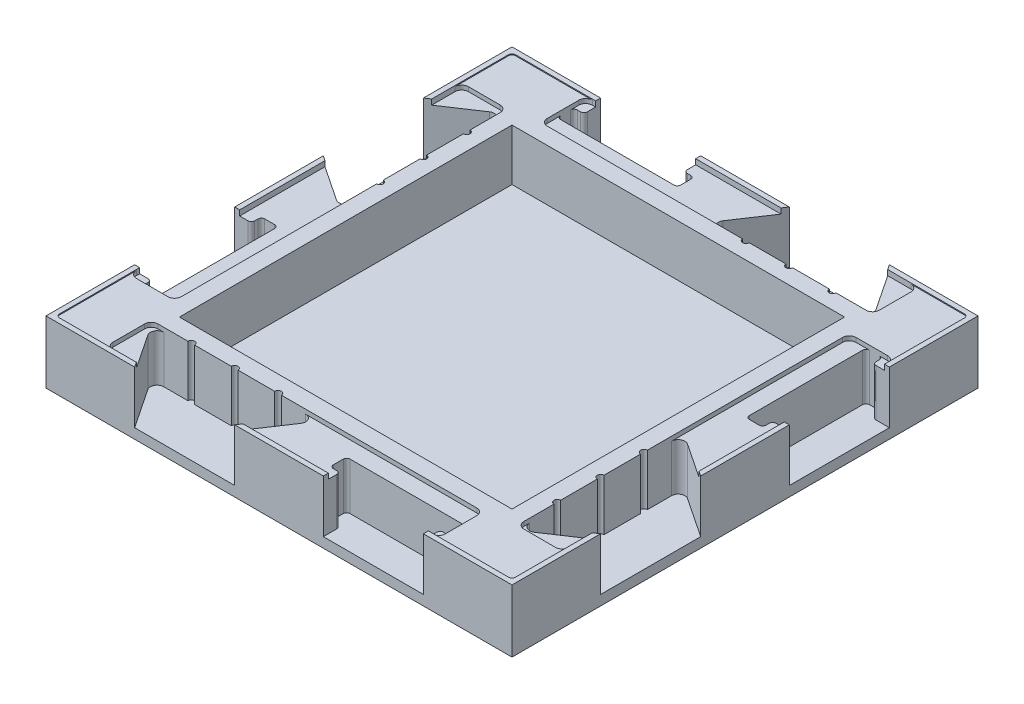
from build123d import *

# Parameters (mm, degrees)
SKETCH1_W           = 139.7
SKETCH1_H           = 139.7
BOSS_EXTRUDE1_DEPTH = 9.375
SKETCH2_W           = 136.7
SKETCH2_H           = 136.7
CUT_EXTRUDE1_DEPTH  = 0.3
CUT_EXTRUDE2_START  = -15.75
CUT_EXTRUDE2_DEPTH  = 117.296543949
CUT_EXTRUDE4_DEPTH  = 15.45
SKETCH9_W           = 99.566666666
SKETCH9_H           = 13.5
CUT_EXTRUDE5_DEPTH  = 1.3
FILLET1_R           = 1
FILLET3_R           = 2
FILLET4_R           = 2
CIRPATTERN1_START   = -6.375
CIRPATTERN1_DEPTH   = 15.75
CIRPATTERN1_START_2 = 7.775
CIRPATTERN1_2_DEPTH = 1.3
SKETCH11_W          = 99.7
SKETCH11_H          = 99.7
CUT_EXTRUDE6_DEPTH  = 15.45


# Read off the part's stored shape, not the designer's step: CirPattern1
with BuildPart() as part:
    # Sketch1 → Boss-Extrude1 (new, symmetric)
    with BuildSketch(Plane(origin=(0, 0, 0), x_dir=(1, 0, 0), z_dir=(0, 1, 0))):
        Rectangle(SKETCH1_W, SKETCH1_H)
    extrude(amount=BOSS_EXTRUDE1_DEPTH, both=True)

    # Sketch2 → Cut-Extrude1 (cut)
    with BuildSketch(Plane(origin=(0, 9.375, 0), x_dir=(1, 0, 0), z_dir=(0, 1, 0))):
        Rectangle(SKETCH2_W, SKETCH2_H)
    extrude(amount=-CUT_EXTRUDE1_DEPTH, mode=Mode.SUBTRACT)

    # Sketch4 → Cut-Extrude2 (cut)
    with BuildSketch(Plane(origin=(0, 9.375, 0), x_dir=(1, 0, 0), z_dir=(0, 1, 0)).offset(CUT_EXTRUDE2_START)):
        Polygon((-43.283333333, -69.85), (-53.283333333, -54.85), (-3.283333333, -54.85), (-13.283333333, -69.85), align=None)
        Polygon((13.283333333, -69.85), (13.283333333, -64.85), (10.283333333, -64.85), (10.283333333, -59.85), (46.283333333, -59.85), (46.283333333, -64.85), (43.283333333, -64.85), (43.283333333, -69.85), align=None)
    extrude(amount=CUT_EXTRUDE2_DEPTH, mode=Mode.SUBTRACT)

    # Sketch6 → Cut-Extrude4 (cut)
    with BuildSketch(Plane(origin=(0, 9.075, 0), x_dir=(1, 0, 0), z_dir=(0, 1, 0))):
        with BuildLine():
            Line((-42.283333333, -54.85), (-40.283333333, -54.85))
            ThreePointArc((-40.283333333, -54.85), (-41.283333333, -53.85), (-42.283333333, -54.85))
        make_face()
        with BuildLine():
            Line((-29.283333333, -54.85), (-27.283333333, -54.85))
            ThreePointArc((-27.283333333, -54.85), (-28.283333333, -53.85), (-29.283333333, -54.85))
        make_face()
        with BuildLine():
            Line((-16.283333333, -54.85), (-14.283333333, -54.85))
            ThreePointArc((-14.283333333, -54.85), (-15.283333333, -53.85), (-16.283333333, -54.85))
        make_face()
    extrude(amount=-CUT_EXTRUDE4_DEPTH, mode=Mode.SUBTRACT)

    # Sketch9 → Cut-Extrude5 (cut)
    with BuildSketch(Plane(origin=(0, 9.075, 0), x_dir=(1, 0, 0), z_dir=(0, 1, 0))):
        with Locations((-3.5, -61.6)):
            Rectangle(SKETCH9_W, SKETCH9_H)
    extrude(amount=-CUT_EXTRUDE5_DEPTH, mode=Mode.SUBTRACT)

    # Fillet1
    fillet1_edges = [part.edges().sort_by_distance(p)[0] for p in [
        (-68.35, 9.225, -68.35),
        (-68.35, 9.225, 68.35),
        (68.35, 9.225, 68.35),
        (68.35, 9.225, -68.35),
        (46.283333333, 0.7, 64.85),
        (46.283333333, 0.7, 59.85),
        (10.283333333, 0.7, 59.85),
        (10.283333333, 0.7, 64.85),
        (13.283333333, 0.7, 64.85),
        (43.283333333, 0.7, 64.85),
    ]]
    fillet(fillet1_edges, radius=FILLET1_R)

    # Fillet3
    fillet3_edges = [part.edges().sort_by_distance(p)[0] for p in [
        (-53.283333333, 0.7, 54.85),
        (-3.283333333, 0.7, 54.85),
    ]]
    fillet(fillet3_edges, radius=FILLET3_R)

    # Fillet4
    fillet4_edges = [part.edges().sort_by_distance(p)[0] for p in [
        (46.283333333, 8.425, 54.85),
        (46.283333333, 8.425, 68.35),
        (-53.283333333, 8.425, 54.85),
        (-53.283333333, 8.425, 68.35),
    ]]
    fillet(fillet4_edges, radius=FILLET4_R)

    # CirPattern1 outline → CirPattern1 (cut)
    with BuildSketch(Plane(origin=(0, 0, 0), x_dir=(1, 0, 0), z_dir=(0, 1, 0)).offset(CIRPATTERN1_START)):
        with BuildLine():
            ThreePointArc((54.85, -14.283333333), (53.85, -15.283333333), (54.85, -16.283333333))
            Line((54.85, -16.283333333), (54.85, -27.283333333))
            ThreePointArc((54.85, -27.283333333), (53.85, -28.283333333), (54.85, -29.283333333))
            Line((54.85, -29.283333333), (54.85, -40.283333333))
            ThreePointArc((54.85, -40.283333333), (53.85, -41.283333333), (54.85, -42.283333333))
            Line((54.85, -42.283333333), (54.85, -49.54629915))
            ThreePointArc((54.85, -49.54629915), (55.906284149, -51.309648347), (57.959400392, -51.210399738))
            Line((57.959400392, -51.210399738), (69.85, -43.283333333))
            Line((69.85, -43.283333333), (69.85, -13.283333333))
            Line((69.85, -13.283333333), (57.959400392, -5.356266928))
            ThreePointArc((57.959400392, -5.356266928), (55.906284149, -5.257018319), (54.85, -7.020367517))
            Line((54.85, -7.020367517), (54.85, -14.283333333))
        make_face()
        with BuildLine():
            Line((-69.85, 43.283333333), (-69.85, 13.283333333))
            Line((-69.85, 13.283333333), (-57.959400392, 5.356266928))
            ThreePointArc((-57.959400392, 5.356266928), (-55.906284149, 5.257018319), (-54.85, 7.020367517))
            Line((-54.85, 7.020367517), (-54.85, 14.283333333))
            ThreePointArc((-54.85, 14.283333333), (-53.85, 15.283333333), (-54.85, 16.283333333))
            Line((-54.85, 16.283333333), (-54.85, 27.283333333))
            ThreePointArc((-54.85, 27.283333333), (-53.85, 28.283333333), (-54.85, 29.283333333))
            Line((-54.85, 29.283333333), (-54.85, 40.283333333))
            ThreePointArc((-54.85, 40.283333333), (-53.85, 41.283333333), (-54.85, 42.283333333))
            Line((-54.85, 42.283333333), (-54.85, 49.54629915))
            ThreePointArc((-54.85, 49.54629915), (-55.906284149, 51.309648347), (-57.959400392, 51.210399738))
            Line((-57.959400392, 51.210399738), (-69.85, 43.283333333))
        make_face()
        with BuildLine():
            Line((43.283333333, 69.85), (13.283333333, 69.85))
            Line((13.283333333, 69.85), (5.356266928, 57.959400392))
            ThreePointArc((5.356266928, 57.959400392), (5.257018319, 55.906284149), (7.020367517, 54.85))
            Line((7.020367517, 54.85), (14.283333333, 54.85))
            ThreePointArc((14.283333333, 54.85), (15.283333333, 53.85), (16.283333333, 54.85))
            Line((16.283333333, 54.85), (27.283333333, 54.85))
            ThreePointArc((27.283333333, 54.85), (28.283333333, 53.85), (29.283333333, 54.85))
            Line((29.283333333, 54.85), (40.283333333, 54.85))
            ThreePointArc((40.283333333, 54.85), (41.283333333, 53.85), (42.283333333, 54.85))
            Line((42.283333333, 54.85), (49.54629915, 54.85))
            ThreePointArc((49.54629915, 54.85), (51.309648347, 55.906284149), (51.210399738, 57.959400392))
            Line((51.210399738, 57.959400392), (43.283333333, 69.85))
        make_face()
        with BuildLine():
            Line((63.85, 46.283333333), (60.85, 46.283333333))
            ThreePointArc((60.85, 46.283333333), (60.142893218, 45.990440115), (59.85, 45.283333333))
            Line((59.85, 45.283333333), (59.85, 11.283333333))
            ThreePointArc((59.85, 11.283333333), (60.142893219, 10.576226552), (60.85, 10.283333333))
            Line((60.85, 10.283333333), (63.85, 10.283333333))
            ThreePointArc((63.85, 10.283333333), (64.557106781, 10.576226552), (64.85, 11.283333333))
            Line((64.85, 11.283333333), (64.85, 12.283333333))
            ThreePointArc((64.85, 12.283333333), (65.142893218, 12.990440114), (65.85, 13.283333333))
            Line((65.85, 13.283333333), (69.85, 13.283333333))
            Line((69.85, 13.283333333), (69.85, 43.283333333))
            Line((69.85, 43.283333333), (65.85, 43.283333333))
            ThreePointArc((65.85, 43.283333333), (65.142893219, 43.576226552), (64.85, 44.283333333))
            Line((64.85, 44.283333333), (64.85, 45.283333333))
            ThreePointArc((64.85, 45.283333333), (64.557106781, 45.990440115), (63.85, 46.283333333))
        make_face()
        with BuildLine():
            Line((-13.283333333, 69.85), (-43.283333333, 69.85))
            Line((-43.283333333, 69.85), (-43.283333333, 65.85))
            ThreePointArc((-43.283333333, 65.85), (-43.576226552, 65.142893219), (-44.283333333, 64.85))
            Line((-44.283333333, 64.85), (-45.283333333, 64.85))
            ThreePointArc((-45.283333333, 64.85), (-45.990440115, 64.557106781), (-46.283333333, 63.85))
            Line((-46.283333333, 63.85), (-46.283333333, 60.85))
            ThreePointArc((-46.283333333, 60.85), (-45.990440115, 60.142893218), (-45.283333333, 59.85))
            Line((-45.283333333, 59.85), (-11.283333333, 59.85))
            ThreePointArc((-11.283333333, 59.85), (-10.576226552, 60.142893219), (-10.283333333, 60.85))
            Line((-10.283333333, 60.85), (-10.283333333, 63.85))
            ThreePointArc((-10.283333333, 63.85), (-10.576226552, 64.557106781), (-11.283333333, 64.85))
            Line((-11.283333333, 64.85), (-12.283333333, 64.85))
            ThreePointArc((-12.283333333, 64.85), (-12.990440114, 65.142893218), (-13.283333333, 65.85))
            Line((-13.283333333, 65.85), (-13.283333333, 69.85))
        make_face()
        with BuildLine():
            Line((-69.85, -13.283333333), (-69.85, -43.283333333))
            Line((-69.85, -43.283333333), (-65.85, -43.283333333))
            ThreePointArc((-65.85, -43.283333333), (-65.142893219, -43.576226552), (-64.85, -44.283333333))
            Line((-64.85, -44.283333333), (-64.85, -45.283333333))
            ThreePointArc((-64.85, -45.283333333), (-64.557106781, -45.990440115), (-63.85, -46.283333333))
            Line((-63.85, -46.283333333), (-60.85, -46.283333333))
            ThreePointArc((-60.85, -46.283333333), (-60.142893218, -45.990440115), (-59.85, -45.283333333))
            Line((-59.85, -45.283333333), (-59.85, -11.283333333))
            ThreePointArc((-59.85, -11.283333333), (-60.142893219, -10.576226552), (-60.85, -10.283333333))
            Line((-60.85, -10.283333333), (-63.85, -10.283333333))
            ThreePointArc((-63.85, -10.283333333), (-64.557106781, -10.576226552), (-64.85, -11.283333333))
            Line((-64.85, -11.283333333), (-64.85, -12.283333333))
            ThreePointArc((-64.85, -12.283333333), (-65.142893218, -12.990440114), (-65.85, -13.283333333))
            Line((-65.85, -13.283333333), (-69.85, -13.283333333))
        make_face()
    extrude(amount=CIRPATTERN1_DEPTH, mode=Mode.SUBTRACT)

    # CirPattern1 2 outline → CirPattern1 2 (cut)
    with BuildSketch(Plane(origin=(0, 0, 0), x_dir=(1, 0, 0), z_dir=(0, 1, 0)).offset(CIRPATTERN1_START_2)):
        with BuildLine():
            Line((54.85, 44.283333333), (54.85, -7.020367517))
            ThreePointArc((54.85, -7.020367517), (55.906284149, -5.257018319), (57.959400392, -5.356266928))
            Line((57.959400392, -5.356266928), (68.35, -12.283333333))
            Line((68.35, -12.283333333), (68.35, 13.283333333))
            Line((68.35, 13.283333333), (65.85, 13.283333333))
            ThreePointArc((65.85, 13.283333333), (65.142893218, 12.990440114), (64.85, 12.283333333))
            Line((64.85, 12.283333333), (64.85, 11.283333333))
            ThreePointArc((64.85, 11.283333333), (64.557106781, 10.576226552), (63.85, 10.283333333))
            Line((63.85, 10.283333333), (60.85, 10.283333333))
            ThreePointArc((60.85, 10.283333333), (60.142893219, 10.576226552), (59.85, 11.283333333))
            Line((59.85, 11.283333333), (59.85, 45.283333333))
            ThreePointArc((59.85, 45.283333333), (60.142893218, 45.990440115), (60.85, 46.283333333))
            Line((60.85, 46.283333333), (56.85, 46.283333333))
            ThreePointArc((56.85, 46.283333333), (55.435786438, 45.697546896), (54.85, 44.283333333))
        make_face()
        with BuildLine():
            ThreePointArc((57.959400392, -51.210399738), (55.906284149, -51.309648347), (54.85, -49.54629915))
            Line((54.85, -49.54629915), (54.85, -51.283333333))
            ThreePointArc((54.85, -51.283333333), (55.435786438, -52.697546896), (56.85, -53.283333333))
            Line((56.85, -53.283333333), (66.35, -53.283333333))
            ThreePointArc((66.35, -53.283333333), (67.764213562, -52.697546896), (68.35, -51.283333333))
            Line((68.35, -51.283333333), (68.35, -44.283333333))
            Line((68.35, -44.283333333), (57.959400392, -51.210399738))
        make_face()
        with BuildLine():
            Line((66.35, 46.283333333), (63.85, 46.283333333))
            ThreePointArc((63.85, 46.283333333), (64.557106781, 45.990440115), (64.85, 45.283333333))
            Line((64.85, 45.283333333), (64.85, 44.283333333))
            ThreePointArc((64.85, 44.283333333), (65.142893219, 43.576226552), (65.85, 43.283333333))
            Line((65.85, 43.283333333), (68.35, 43.283333333))
            Line((68.35, 43.283333333), (68.35, 44.283333333))
            ThreePointArc((68.35, 44.283333333), (67.764213562, 45.697546896), (66.35, 46.283333333))
        make_face()
        with BuildLine():
            Line((51.283333333, 68.35), (44.283333333, 68.35))
            Line((44.283333333, 68.35), (51.210399738, 57.959400392))
            ThreePointArc((51.210399738, 57.959400392), (51.309648347, 55.906284149), (49.54629915, 54.85))
            Line((49.54629915, 54.85), (51.283333333, 54.85))
            ThreePointArc((51.283333333, 54.85), (52.697546896, 55.435786438), (53.283333333, 56.85))
            Line((53.283333333, 56.85), (53.283333333, 66.35))
            ThreePointArc((53.283333333, 66.35), (52.697546896, 67.764213562), (51.283333333, 68.35))
        make_face()
        with BuildLine():
            Line((5.356266928, 57.959400392), (12.283333333, 68.35))
            Line((12.283333333, 68.35), (-13.283333333, 68.35))
            Line((-13.283333333, 68.35), (-13.283333333, 65.85))
            ThreePointArc((-13.283333333, 65.85), (-12.990440114, 65.142893218), (-12.283333333, 64.85))
            Line((-12.283333333, 64.85), (-11.283333333, 64.85))
            ThreePointArc((-11.283333333, 64.85), (-10.576226552, 64.557106781), (-10.283333333, 63.85))
            Line((-10.283333333, 63.85), (-10.283333333, 60.85))
            ThreePointArc((-10.283333333, 60.85), (-10.576226552, 60.142893219), (-11.283333333, 59.85))
            Line((-11.283333333, 59.85), (-45.283333333, 59.85))
            ThreePointArc((-45.283333333, 59.85), (-45.990440115, 60.142893218), (-46.283333333, 60.85))
            Line((-46.283333333, 60.85), (-46.283333333, 56.85))
            ThreePointArc((-46.283333333, 56.85), (-45.697546896, 55.435786438), (-44.283333333, 54.85))
            Line((-44.283333333, 54.85), (7.020367517, 54.85))
            ThreePointArc((7.020367517, 54.85), (5.257018319, 55.906284149), (5.356266928, 57.959400392))
        make_face()
        with BuildLine():
            Line((-43.283333333, 65.85), (-43.283333333, 68.35))
            Line((-43.283333333, 68.35), (-44.283333333, 68.35))
            ThreePointArc((-44.283333333, 68.35), (-45.697546896, 67.764213562), (-46.283333333, 66.35))
            Line((-46.283333333, 66.35), (-46.283333333, 63.85))
            ThreePointArc((-46.283333333, 63.85), (-45.990440115, 64.557106781), (-45.283333333, 64.85))
            Line((-45.283333333, 64.85), (-44.283333333, 64.85))
            ThreePointArc((-44.283333333, 64.85), (-43.576226552, 65.142893219), (-43.283333333, 65.85))
        make_face()
        with BuildLine():
            Line((-68.35, 51.283333333), (-68.35, 44.283333333))
            Line((-68.35, 44.283333333), (-57.959400392, 51.210399738))
            ThreePointArc((-57.959400392, 51.210399738), (-55.906284149, 51.309648347), (-54.85, 49.54629915))
            Line((-54.85, 49.54629915), (-54.85, 51.283333333))
            ThreePointArc((-54.85, 51.283333333), (-55.435786438, 52.697546896), (-56.85, 53.283333333))
            Line((-56.85, 53.283333333), (-66.35, 53.283333333))
            ThreePointArc((-66.35, 53.283333333), (-67.764213562, 52.697546896), (-68.35, 51.283333333))
        make_face()
        with BuildLine():
            Line((-57.959400392, 5.356266928), (-68.35, 12.283333333))
            Line((-68.35, 12.283333333), (-68.35, -13.283333333))
            Line((-68.35, -13.283333333), (-65.85, -13.283333333))
            ThreePointArc((-65.85, -13.283333333), (-65.142893218, -12.990440114), (-64.85, -12.283333333))
            Line((-64.85, -12.283333333), (-64.85, -11.283333333))
            ThreePointArc((-64.85, -11.283333333), (-64.557106781, -10.576226552), (-63.85, -10.283333333))
            Line((-63.85, -10.283333333), (-60.85, -10.283333333))
            ThreePointArc((-60.85, -10.283333333), (-60.142893219, -10.576226552), (-59.85, -11.283333333))
            Line((-59.85, -11.283333333), (-59.85, -45.283333333))
            ThreePointArc((-59.85, -45.283333333), (-60.142893218, -45.990440115), (-60.85, -46.283333333))
            Line((-60.85, -46.283333333), (-56.85, -46.283333333))
            ThreePointArc((-56.85, -46.283333333), (-55.435786438, -45.697546896), (-54.85, -44.283333333))
            Line((-54.85, -44.283333333), (-54.85, 7.020367517))
            ThreePointArc((-54.85, 7.020367517), (-55.906284149, 5.257018319), (-57.959400392, 5.356266928))
        make_face()
        with BuildLine():
            Line((-65.85, -43.283333333), (-68.35, -43.283333333))
            Line((-68.35, -43.283333333), (-68.35, -44.283333333))
            ThreePointArc((-68.35, -44.283333333), (-67.764213562, -45.697546896), (-66.35, -46.283333333))
            Line((-66.35, -46.283333333), (-63.85, -46.283333333))
            ThreePointArc((-63.85, -46.283333333), (-64.557106781, -45.990440115), (-64.85, -45.283333333))
            Line((-64.85, -45.283333333), (-64.85, -44.283333333))
            ThreePointArc((-64.85, -44.283333333), (-65.142893219, -43.576226552), (-65.85, -43.283333333))
        make_face()
    extrude(amount=CIRPATTERN1_2_DEPTH, mode=Mode.SUBTRACT)

    # Sketch11 → Cut-Extrude6 (cut)
    with BuildSketch(Plane(origin=(0, 9.075, 0), x_dir=(1, 0, 0), z_dir=(0, 1, 0))):
        Rectangle(SKETCH11_W, SKETCH11_H)
    extrude(amount=-CUT_EXTRUDE6_DEPTH, mode=Mode.SUBTRACT)


solid = part.part
